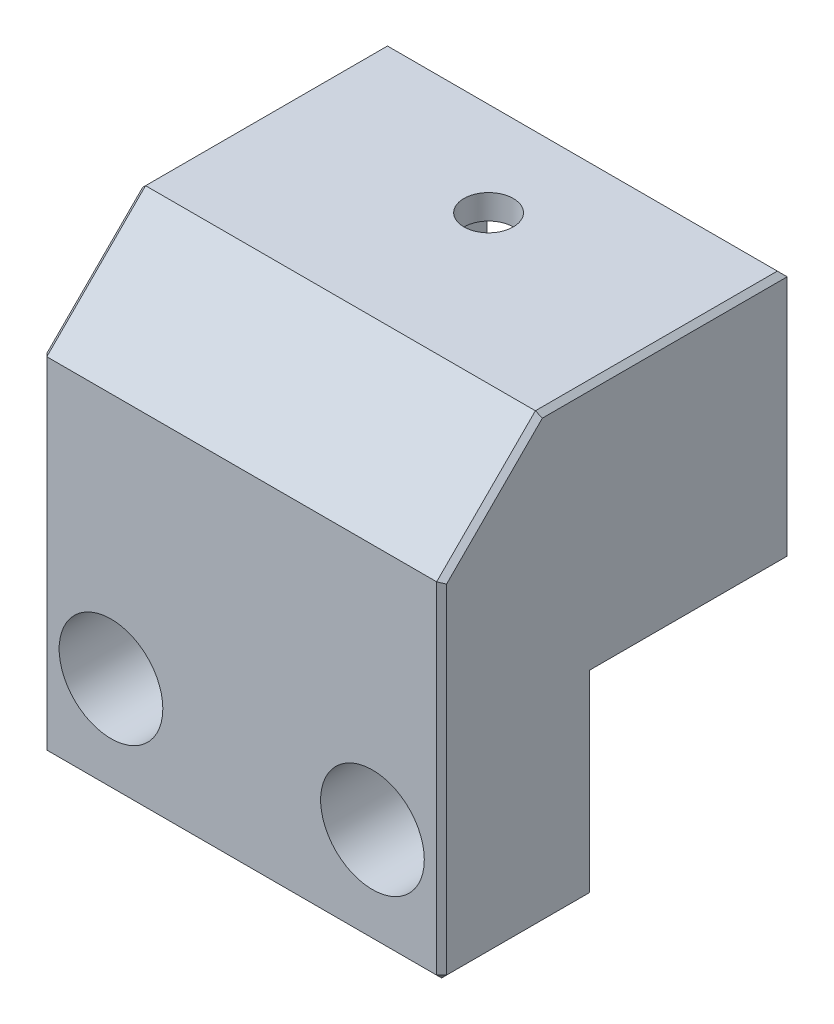
from build123d import *

# Parameters (mm, degrees)
SKETCH1_W                       = 40.48
SKETCH1_H                       = 20
SKETCH1_R                       = 2.5
BOSS_EXTRUDE1_DEPTH             = 25
SKETCH9_W                       = 40.48
SKETCH9_H                       = 45
BOSS_EXTRUDE4_DEPTH             = 15
CUT_EXTRUDE2_START              = -2.5
CUT_EXTRUDE2_DEPTH              = 19.5
CHAMFER1_SIZE                   = 10
CBORE_FOR_M5_SBHCS1_D           = 5.5
CBORE_FOR_M5_SBHCS1_CBORE_D     = 10.5
CBORE_FOR_M5_SBHCS1_CBORE_DEPTH = 9.75
CHAMFER2_SIZE                   = 0.5


with BuildPart() as part:
    # Sketch1 → Boss-Extrude1 (new body)
    with BuildSketch(Plane(origin=(0, 0, 0), x_dir=(1, 0, 0), z_dir=(0, 1, 0))):
        Rectangle(SKETCH1_W, SKETCH1_H)
        Circle(SKETCH1_R, mode=Mode.SUBTRACT)
    extrude(amount=BOSS_EXTRUDE1_DEPTH)

    # Sketch9 → Boss-Extrude4 (add)
    with BuildSketch(Plane.XY.offset(10)):
        with Locations((0, 2.5)):
            Rectangle(SKETCH9_W, SKETCH9_H)
    extrude(amount=BOSS_EXTRUDE4_DEPTH)

    # Sketch10 → Cut-Extrude2 (cut)
    with BuildSketch(Plane(origin=(0, 25, 0), x_dir=(1, 0, 0), z_dir=(0, 1, 0)).offset(CUT_EXTRUDE2_START)):
        with BuildLine():
            Line((10.16, 0), (10.16, 10))
            Line((10.16, 10), (-10.16, 10))
            Line((-10.16, 10), (-10.16, 0))
            ThreePointArc((-10.16, 0), (0, -10.16), (10.16, 0))
        make_face()
    extrude(amount=-CUT_EXTRUDE2_DEPTH, mode=Mode.SUBTRACT)

    # Chamfer1
    chamfer1_edges = [part.edges().sort_by_distance(p)[0] for p in [
        (0, 25, 25),
    ]]
    chamfer(chamfer1_edges, length=CHAMFER1_SIZE)

    # CBORE for M5 SBHCS1 (through all)
    with Locations(Plane.XY.offset(25)):
        with Locations((-13.24, -10), (13.24, -10)):
            CounterBoreHole(CBORE_FOR_M5_SBHCS1_D / 2, CBORE_FOR_M5_SBHCS1_CBORE_D / 2, CBORE_FOR_M5_SBHCS1_CBORE_DEPTH)

    # Chamfer2
    chamfer2_edges = [part.edges().sort_by_distance(p)[0] for p in [
        (20.24, -20, 17.5),
        (-20.24, -20, 17.5),
        (20.24, 20, 20),
        (20.24, 25, 2.5),
        (0, 25, -10),
        (-20.24, 25, 2.5),
        (-20.24, 20, 20),
        (20.24, -2.5, 25),
        (0, -20, 25),
        (-20.24, -2.5, 25),
    ]]
    chamfer(chamfer2_edges, length=CHAMFER2_SIZE)


solid = part.part
